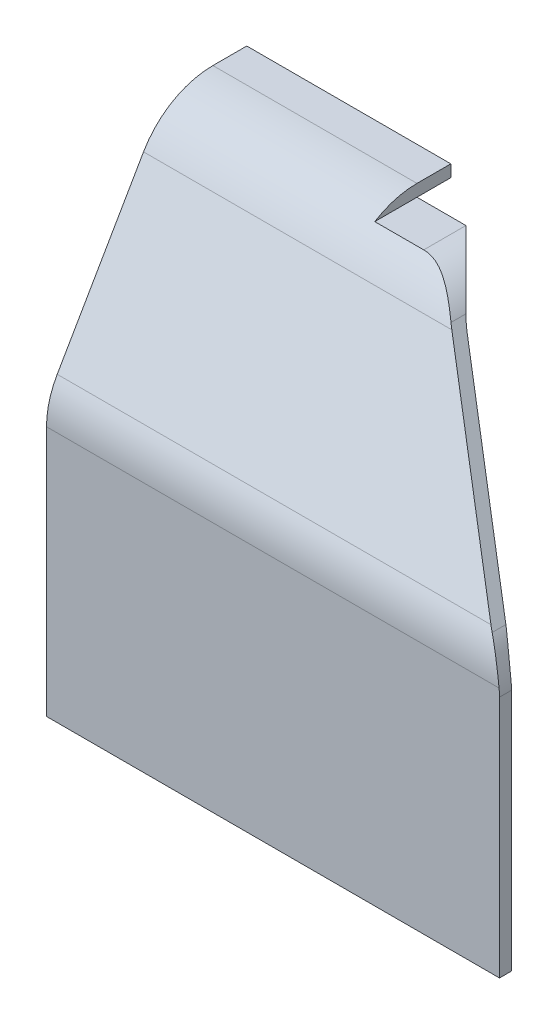
from build123d import *

# Parameters (mm, degrees)
SALIENTE_EXTRUIR1_DEPTH = 58.05
REDONDEO1_R             = 20
REDONDEO2_R             = 20
REDONDEO3_R             = 17
REDONDEO4_R             = 17
CORTAR_EXTRUIR1_DEPTH   = 50


with BuildPart() as part:
    # Croquis1 → Saliente-Extruir1 (new, symmetric)
    with BuildSketch(Plane(origin=(0, 0, 0), x_dir=(0, 0, -1), z_dir=(1, 0, 0))):
        Polygon((0, 0), (0, 67.19615242270665), (28.732050807568744, 116.9615242270664), (46.99999999999986, 116.96152422706639), (46.99999999999986, 119.96152422706642), (26.999999999999858, 119.9615242270664), (-2.9999999999999996, 68), (-2.9999999999999973, 0), align=None)
    extrude(amount=SALIENTE_EXTRUIR1_DEPTH, both=True)

    # Redondeo1
    redondeo1_edges = [part.edges().sort_by_distance(p)[0] for p in [
        (0, 68, 2.9999999999999996),
    ]]
    fillet(redondeo1_edges, radius=REDONDEO1_R)

    # Redondeo2
    redondeo2_edges = [part.edges().sort_by_distance(p)[0] for p in [
        (0, 119.9615242270664, -26.999999999999858),
    ]]
    fillet(redondeo2_edges, radius=REDONDEO2_R)

    # Redondeo3
    redondeo3_edges = [part.edges().sort_by_distance(p)[0] for p in [
        (0, 116.9615242270664, -28.732050807568744),
    ]]
    fillet(redondeo3_edges, radius=REDONDEO3_R)

    # Redondeo4
    redondeo4_edges = [part.edges().sort_by_distance(p)[0] for p in [
        (0, 67.19615242270665, 0),
    ]]
    fillet(redondeo4_edges, radius=REDONDEO4_R)

    # Croquis3 → Cortar-Extruir1 (cut, symmetric)
    with BuildSketch(Plane(origin=(0, 0, 0), x_dir=(-1, 0, 0), z_dir=(0, 0, -1))):
        with BuildLine():
            Line((-55.04999999999999, 0), (-55.04999999999999, 60.72059531467597))
            ThreePointArc((-55.04999999999999, 60.72059531467597), (-54.02477455336044, 66.53493775121233), (-51.07275553302264, 71.64798467934712))
            Line((-51.07275553302264, 71.64798467934712), (-18.145706555582095, 110.8889135917375))
            ThreePointArc((-18.145706555582095, 110.8889135917375), (-12.307461472151356, 115.3687566066894), (-5.122951022559453, 116.96152422706638))
            Line((-5.122951022559453, 116.96152422706638), (7.100895814340529, 116.96152422706638))
            Line((7.100895814340529, 116.96152422706638), (7.100895814340529, 119.96152422706638))
            Line((7.100895814340529, 119.96152422706638), (-3.5729510225593932, 119.96152422706638))
            Line((-3.5729510225593932, 119.96152422706638), (-58.050000000000004, 119.96152422706642))
            Line((-58.050000000000004, 119.96152422706642), (-58.05, 60.7205953146759))
            Line((-58.05, 60.7205953146759), (-58.04999999999999, 0))
            Line((-58.04999999999999, 0), (-55.04999999999999, 0))
        make_face()
    extrude(amount=CORTAR_EXTRUIR1_DEPTH, both=True, mode=Mode.SUBTRACT)


solid = part.part
